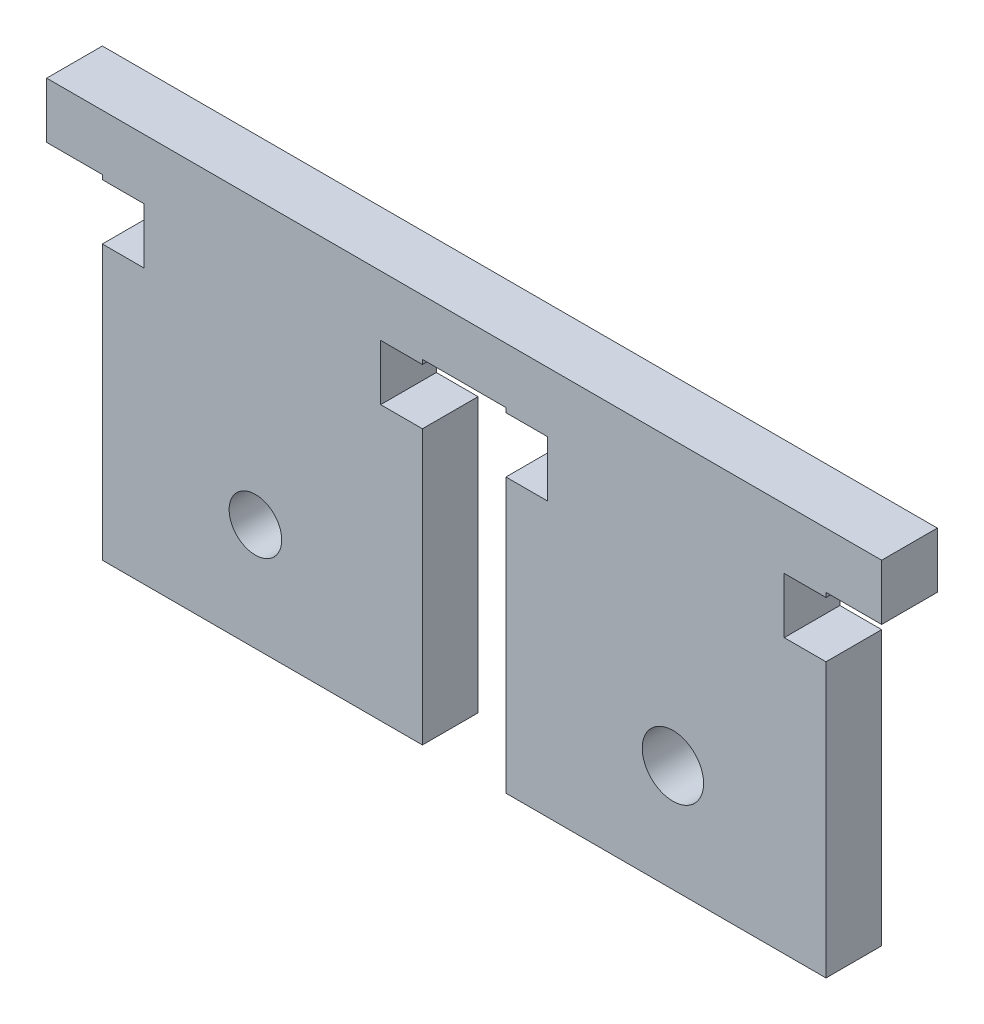
from build123d import *

# Parameters (mm, degrees)
SKETCH3_W           = 95.25
SKETCH3_H           = 60.96
BOSS_EXTRUDE1_DEPTH = 6.35
SKETCH4_W           = 6.35
SKETCH4_H           = 45.72
SKETCH4_W_2         = 9.525
CUT_EXTRUDE1_DEPTH  = 6.35
SKETCH5_W           = 11.143662159
SKETCH5_H           = 6.35
SKETCH5_W_2         = 4.7625
CUT_EXTRUDE2_DEPTH  = 6.35
SKETCH9_W           = 95.25
SKETCH9_H           = 6.35
CUT_EXTRUDE6_DEPTH  = 8.89
SKETCH10_R          = 3
SKETCH10_R_2        = 3.5
CUT_EXTRUDE7_DEPTH  = 6.35
SKETCH11_W          = 82.55
SKETCH11_H          = 6.35
CUT_EXTRUDE9_DEPTH  = 7.62


with BuildPart() as part:
    # Sketch3 → Boss-Extrude1 (new body)
    with BuildSketch(Plane.XY):
        Rectangle(SKETCH3_W, SKETCH3_H)
    extrude(amount=BOSS_EXTRUDE1_DEPTH)

    # Sketch4 → Cut-Extrude1 (cut)
    with BuildSketch(Plane.XY.offset(6.35)):
        with Locations((-44.45, -7.62)):
            Rectangle(SKETCH4_W, SKETCH4_H)
        with Locations((0, -7.62)):
            Rectangle(SKETCH4_W_2, SKETCH4_H)
        with Locations((44.45, -7.62)):
            Rectangle(SKETCH4_W, SKETCH4_H)
    extrude(amount=-CUT_EXTRUDE1_DEPTH, mode=Mode.SUBTRACT)

    # Sketch5 → Cut-Extrude2 (cut)
    with BuildSketch(Plane.XY.offset(6.35)):
        with Locations((-42.08433108, 11.557)):
            Rectangle(SKETCH5_W, SKETCH5_H)
        with Locations((-7.14375, 11.557)):
            Rectangle(SKETCH5_W_2, SKETCH5_H)
    cut_extrude2 = extrude(amount=-CUT_EXTRUDE2_DEPTH, mode=Mode.SUBTRACT)

    # Mirror1: Cut-Extrude2 across plane
    add(cut_extrude2.mirror(Plane(origin=(0, 0, 0), x_dir=(0, 0, 1), z_dir=(1, 0, 0))), mode=Mode.SUBTRACT)

    # Sketch9 → Cut-Extrude6 (cut)
    with BuildSketch(Plane(origin=(0, 30.48, 0), x_dir=(1, 0, 0), z_dir=(0, 1, 0))):
        with Locations((0, -3.175)):
            Rectangle(SKETCH9_W, SKETCH9_H)
    extrude(amount=-CUT_EXTRUDE6_DEPTH, mode=Mode.SUBTRACT)

    # Sketch10 → Cut-Extrude7 (cut)
    with BuildSketch(Plane.XY.offset(6.35)):
        with Locations((-23.8125, -10.6279)):
            Circle(SKETCH10_R)
        with Locations((23.81377, -10.6279)):
            Circle(SKETCH10_R_2)
    extrude(amount=-CUT_EXTRUDE7_DEPTH, mode=Mode.SUBTRACT)

    # Sketch11 → Cut-Extrude9 (cut)
    with BuildSketch(Plane.XZ.offset(30.48)):
        with Locations((0, 3.175)):
            Rectangle(SKETCH11_W, SKETCH11_H)
    extrude(amount=-CUT_EXTRUDE9_DEPTH, mode=Mode.SUBTRACT)


solid = part.part
